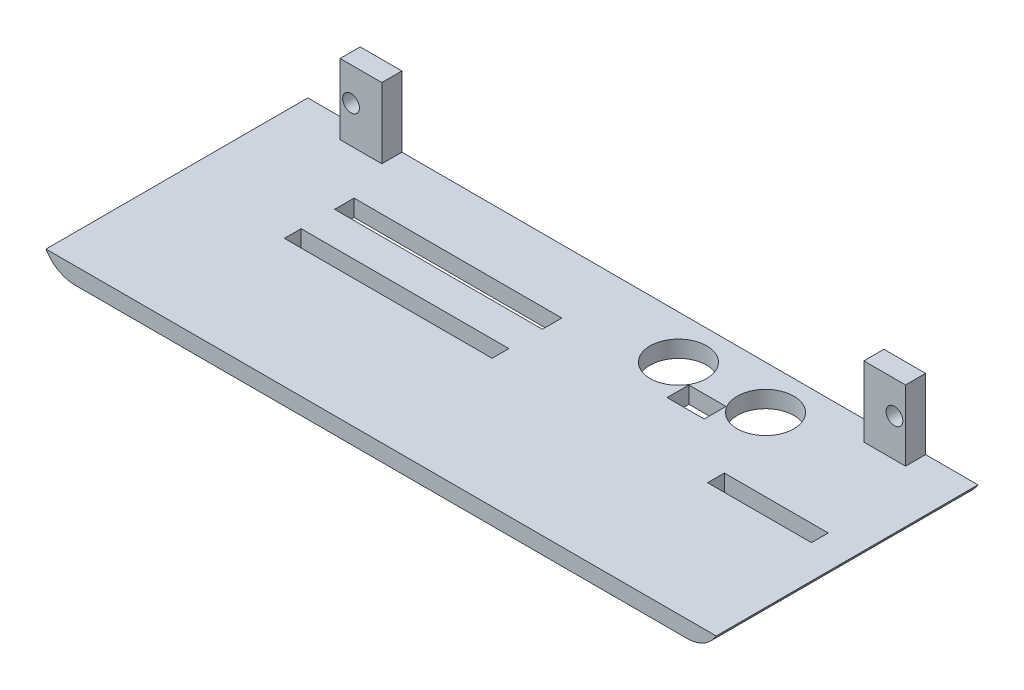
from build123d import *

# Parameters (mm, degrees)
CROQUIS2_W              = 200
CROQUIS2_H              = 150
CROQUIS2_R              = 2
CROQUIS2_R_2            = 2.5
CROQUIS2_W_2            = 31.297292299
CROQUIS2_H_2            = 43.768728426
CROQUIS2_H_3            = 43.768728427
CROQUIS2_W_3            = 23.573907934
CROQUIS2_H_4            = 45.323962431
SALIENTE_EXTRUIR1_DEPTH = 2
REDONDEO1_R             = 10
BOSS_EXTRUDE1_DEPTH     = 25
SKETCH3_W               = 62.040442094
SKETCH3_H               = 5.530821024
BOSS_EXTRUDE2_DEPTH     = 22
SKETCH8_W               = 62.040442094
SKETCH8_H               = 5.530821024
BOSS_EXTRUDE6_DEPTH     = 13
SKETCH2_W               = 200
SKETCH2_H               = 78.124132015
SKETCH2_W_2             = 62.040442094
SKETCH2_H_2             = 5.530821024
BOSS_EXTRUDE3_DEPTH     = 5
SKETCH4_W               = 62.040442094
SKETCH4_H               = 5.530821024
BOSS_EXTRUDE4_DEPTH     = 19
SKETCH5_W               = 7.442573222
SKETCH5_H               = 2.991451355
BOSS_EXTRUDE5_DEPTH     = 21
SKETCH6_R               = 2.5
CUT_EXTRUDE1_DEPTH      = 151.539762497
FILLET1_R               = 10
CUT_EXTRUDE2_DEPTH      = 153.054859813
CUT_EXTRUDE2_DEPTH_BACK = 13
SKETCH9_R               = 2.463920505
SKETCH9_R_2             = 2.5
SKETCH9_W               = 62.040442094
SKETCH9_H               = 4.214652984
CUT_EXTRUDE3_DEPTH      = 26
CUT_EXTRUDE3_DEPTH_BACK = 215.68865463
SKETCH10_W              = 2
SKETCH10_H              = 21
SKETCH11_W              = 62
SKETCH11_H              = 5.8
SKETCH11_H_2            = 5
SKETCH11_W_2            = 31
CUT_EXTRUDE4_DEPTH      = 130.932832439
CROQUIS4_W              = 2.991451355
CROQUIS4_H              = 16
SALIENTE_EXTRUIR2_DEPTH = 5
CROQUIS5_W              = 12.442573222
CROQUIS5_H              = 2.991451355
SALIENTE_EXTRUIR3_DEPTH = 5
CROQUIS7_W              = 12.442573222
CROQUIS7_H              = 21
SALIENTE_EXTRUIR4_DEPTH = 3
CORTAR_EXTRUIR3_START   = -15
CROQUIS8_R              = 2.5
CORTAR_EXTRUIR3_DEPTH   = 15
CROQUIS9_W              = 2.991451355
CROQUIS9_H              = 16
SALIENTE_EXTRUIR5_DEPTH = 5
CROQUIS10_W             = 12.442573222
CROQUIS10_H             = 2.991451355
SALIENTE_EXTRUIR6_DEPTH = 5
CROQUIS11_W             = 12.442573222
CROQUIS11_H             = 21
SALIENTE_EXTRUIR7_DEPTH = 3
CORTAR_EXTRUIR4_START   = -11
CROQUIS12_R             = 2.5
CORTAR_EXTRUIR4_DEPTH   = 11
CROQUIS15_R             = 8.45
CROQUIS15_W             = 10
CROQUIS15_H             = 5
CORTAR_EXTRUIR8_DEPTH   = 111
CORTAR_EXTRUIR10_DEPTH  = 10


with BuildPart() as part:
    # Croquis2 → Saliente-Extruir1 (new body)
    with BuildSketch(Plane.XY):
        with Locations((0.108263467, -0.36008145)):
            Rectangle(CROQUIS2_W, CROQUIS2_H)
        with Locations((89.108263467, -66.5)):
            Circle(CROQUIS2_R, mode=Mode.SUBTRACT)
        with Locations((-88.891736533, -66.5)):
            Circle(CROQUIS2_R, mode=Mode.SUBTRACT)
        with Locations(Location((89.108263467, 65.779837101, 0), (0, 0, 180))):
            Circle(CROQUIS2_R, mode=Mode.SUBTRACT)
        with Locations(Location((-88.891736533, 65.779837101, 0), (0, 0, 180))):
            Circle(CROQUIS2_R, mode=Mode.SUBTRACT)
        with Locations((-80.865436179, -59.36008145)):
            Circle(CROQUIS2_R_2, mode=Mode.SUBTRACT)
        with Locations((81.108263467, -59.36008145)):
            Circle(CROQUIS2_R_2, mode=Mode.SUBTRACT)
        with Locations(Location((81.108263467, 58.63991855, 0), (0, 0, 180))):
            Circle(CROQUIS2_R_2, mode=Mode.SUBTRACT)
        with Locations(Location((-80.865436179, 58.63991855, 0), (0, 0, 180))):
            Circle(CROQUIS2_R_2, mode=Mode.SUBTRACT)
        with BuildLine():
            Line((-62.091736533, 70.63991855), (64.108263467, 70.63991855))
            ThreePointArc((64.108263467, 70.63991855), (66.108263467, 68.63991855), (64.108263467, 66.63991855))
            Line((64.108263467, 66.63991855), (-62.091736533, 66.63991855))
            ThreePointArc((-62.091736533, 66.63991855), (-64.091736533, 68.63991855), (-62.091736533, 70.63991855))
        make_face(mode=Mode.SUBTRACT)
        Polygon((-71.391736533, -12.902447307), (-71.391736533, 12.182284408), (-79.241736533, 12.28991855), (-83.891736533, 12.28991855), (-83.891736533, -13.01008145), (-79.241736533, -13.01008145), align=None, mode=Mode.SUBTRACT)
        with BuildLine():
            Line((92.108263467, 45.478381757), (92.108263467, -46.198544657))
            ThreePointArc((92.108263467, -46.198544657), (90.807295546, -47.897576736), (89.108263467, -46.596608814))
            Line((89.108263467, -46.596608814), (89.108263467, 45.876445915))
            ThreePointArc((89.108263467, 45.876445915), (90.807295546, 47.177413836), (92.108263467, 45.478381757))
        make_face(mode=Mode.SUBTRACT)
        Polygon((84.108263467, 12.28991855), (84.108263467, -13.01008145), (79.458263467, -13.01008145), (71.608263467, -13.01008145), (71.608263467, 12.28991855), (79.458263467, 12.28991855), align=None, mode=Mode.SUBTRACT)
        with BuildLine():
            Line((-91.891736533, 45.478381757), (-91.891736533, -46.198544657))
            ThreePointArc((-91.891736533, -46.198544657), (-90.590768612, -47.897576736), (-88.891736533, -46.596608814))
            Line((-88.891736533, -46.596608814), (-88.891736533, 45.876445915))
            ThreePointArc((-88.891736533, 45.876445915), (-90.590768612, 47.177413836), (-91.891736533, 45.478381757))
        make_face(mode=Mode.SUBTRACT)
        with Locations((-30.011405388, 36.299005811)):
            Rectangle(CROQUIS2_W_2, CROQUIS2_H_2, mode=Mode.SUBTRACT)
        with BuildLine():
            Line((-62.091736533, -71.36008145), (64.108263467, -71.36008145))
            ThreePointArc((64.108263467, -71.36008145), (66.108263467, -69.36008145), (64.108263467, -67.36008145))
            Line((64.108263467, -67.36008145), (-62.091736533, -67.36008145))
            ThreePointArc((-62.091736533, -67.36008145), (-64.091736533, -69.36008145), (-62.091736533, -71.36008145))
        make_face(mode=Mode.SUBTRACT)
        with Locations((-30.011405388, -26.799059535)):
            Rectangle(CROQUIS2_W_2, CROQUIS2_H_3, mode=Mode.SUBTRACT)
        with Locations((12.982877294, -0.693345879)):
            Rectangle(CROQUIS2_W_3, CROQUIS2_H_4, mode=Mode.SUBTRACT)
    extrude(amount=SALIENTE_EXTRUIR1_DEPTH)

    # Redondeo1
    redondeo1_edges = [part.edges().sort_by_distance(p)[0] for p in [
        (100.108263467, -75.36008145, 1),
        (-99.891736533, -75.36008145, 1),
        (-99.891736533, 74.63991855, 1),
        (100.108263467, 74.63991855, 1),
    ]]
    fillet(redondeo1_edges, radius=REDONDEO1_R)

    # Sketch1 → Boss-Extrude1 (add)
    with BuildSketch(Plane.XY.offset(2)):
        Polygon((-67.071845217, 64.63991855), (-67.071845217, 60.63991855), (-8.841198185, 60.63991855), (-8.841198185, 3.63991855), (-67.071845217, 3.63991855), (-67.071845217, -0.36008145), (-8.841198185, -0.36008145), (-8.841198185, -53.36008145), (-67.071845217, -53.36008145), (-67.071845217, -57.574734434), (-5.031403123, -57.574734434), (-5.031403123, -40.931443482), (46.608263467, -40.931443482), (46.608263467, -36.931443482), (-5.031403123, -36.931443482), (-5.031403123, 30.068556518), (46.608263467, 30.068556518), (46.608263467, 34.068556518), (-5.031403123, 34.068556518), (-5.031403123, 64.63991855), align=None)
    extrude(amount=BOSS_EXTRUDE1_DEPTH)

    # Sketch3 → Boss-Extrude2 (add)
    with BuildSketch(Plane.XZ.offset(57.574734434)):
        with Locations((-36.05162417, 24.234589488)):
            Rectangle(SKETCH3_W, SKETCH3_H)
    extrude(amount=BOSS_EXTRUDE2_DEPTH)

    # Sketch8 → Boss-Extrude6 (add)
    with BuildSketch(Plane(origin=(0, 64.63991855, 0), x_dir=(1, 0, 0), z_dir=(0, 1, 0))):
        with Locations((-36.05162417, -24.234589488)):
            Rectangle(SKETCH8_W, SKETCH8_H)
    extrude(amount=BOSS_EXTRUDE6_DEPTH)

    # Sketch2 → Boss-Extrude3 (add)
    with BuildSketch(Plane.XZ.offset(75.36008145)):
        with Locations((0.108263467, 41.062066008)):
            Rectangle(SKETCH2_W, SKETCH2_H)
        with Locations((-36.05162417, 24.234589488)):
            Rectangle(SKETCH2_W_2, SKETCH2_H_2, mode=Mode.SUBTRACT)
    extrude(amount=-BOSS_EXTRUDE3_DEPTH)

    # Sketch4 → Boss-Extrude4 (add)
    with BuildSketch(Plane(origin=(0, 64.63991855, 0), x_dir=(1, 0, 0), z_dir=(0, 1, 0))):
        with Locations((-36.05162417, -24.234589488)):
            Rectangle(SKETCH4_W, SKETCH4_H)
    extrude(amount=BOSS_EXTRUDE4_DEPTH)

    # Sketch5 → Boss-Extrude5 (add)
    with BuildSketch(Plane.XZ.offset(75.36008145)):
        with Locations((-80.540187187, 3.495725678)):
            Rectangle(SKETCH5_W, SKETCH5_H)
        with Locations((80.756714122, 3.495725678)):
            Rectangle(SKETCH5_W, SKETCH5_H)
    extrude(amount=-BOSS_EXTRUDE5_DEPTH)

    # Sketch6 → Cut-Extrude1 (cut, through all)
    with BuildSketch(Plane.XY.offset(4.991451355)):
        with Locations((-80.996023003, -59.284349751)):
            Circle(SKETCH6_R)
        with Locations(Location((81.166025964, -59.051385225, 0), (0, 0, 345.800348631))):
            Circle(SKETCH6_R)
    extrude(amount=-CUT_EXTRUDE1_DEPTH, mode=Mode.SUBTRACT)

    # Fillet1
    # the kernel refuses this fillet: 10 mm, written as the material it takes off along each edge
    with BuildSketch(Plane(origin=(-99.891736533, -75.36008145, 101.77476711), x_dir=(1, 0, 0), z_dir=(0, 0, -1)), Plane(origin=(100.108263467, -75.36008145, -19.650635095), x_dir=(-1, 0, 0), z_dir=(0, 0, 1))) as fillet1_piece_1:
        with BuildLine():
            CenterArc((8.660254038, -10), FILLET1_R, 90, 60)
            Line((0, -5), (-0.173205081, -4.9))
            ThreePointArc((-0.173205081, -4.9), (-0.2, -2.5), (-0.2, 0))
            Line((-0.2, 0), (0, 0.2))
            Line((0, 0.2), (8.660254038, 0.2))
            Line((8.660254038, 0.2), (8.660254038, 0))
        make_face()
    extrude(amount=121.425402204, mode=Mode.SUBTRACT)

    # Sketch9 → Cut-Extrude2 (cut, two sides: drawn at the far end of the back side and taken through both)
    with BuildSketch(Plane.XY.offset(2).offset(-CUT_EXTRUDE2_DEPTH_BACK)):
        with Locations((-80.996023003, -59.284349751)):
            Circle(SKETCH9_R)
        with Locations(Location((81.166025964, -59.051385225, 0), (0, 0, 345.800348631))):
            Circle(SKETCH9_R_2)
        Polygon((-84.261473798, -70.36008145), (-84.261473798, -54.36008145), (-76.818900576, -54.36008145), (-76.818900576, -70.36008145), (77.035427511, -70.36008145), (77.035427511, -54.36008145), (84.478000733, -54.36008145), (84.478000733, -70.36008145), (100.108263467, -70.36008145), (100.108263467, 85.68147533), (-108.295057911, 85.68147533), (-108.295057911, -70.36008145), align=None)
        with Locations((-36.05162417, -77.467407942)):
            Rectangle(SKETCH9_W, SKETCH9_H)
    extrude(amount=CUT_EXTRUDE2_DEPTH + CUT_EXTRUDE2_DEPTH_BACK, mode=Mode.SUBTRACT)

    # Sketch10 → Cut-Extrude3 (cut, two sides: drawn at the far end of the back side and taken through both)
    with BuildSketch(Plane.ZY.offset(84.261473798).offset(-CUT_EXTRUDE3_DEPTH_BACK)):
        with Locations((1, -64.86008145)):
            Rectangle(SKETCH10_W, SKETCH10_H)
    extrude(amount=CUT_EXTRUDE3_DEPTH + CUT_EXTRUDE3_DEPTH_BACK, mode=Mode.SUBTRACT)

    # Sketch11 → Cut-Extrude4 (cut, through all)
    with BuildSketch(Plane.XZ.offset(75.36008145)):
        with Locations((-36.091736533, 23.891451355)):
            Rectangle(SKETCH11_W, SKETCH11_H)
        with Locations((-36.091736533, 39.291451355)):
            Rectangle(SKETCH11_W, SKETCH11_H_2)
        with Locations((74.708263467, 39.291451355)):
            Rectangle(SKETCH11_W_2, SKETCH11_H_2)
    extrude(amount=-CUT_EXTRUDE4_DEPTH, mode=Mode.SUBTRACT)

    # Croquis4 → Saliente-Extruir2 (add)
    with BuildSketch(Plane.ZY.offset(-77.035427511)):
        with Locations((3.495725678, -62.36008145)):
            Rectangle(CROQUIS4_W, CROQUIS4_H)
    extrude(amount=SALIENTE_EXTRUIR2_DEPTH)

    # Croquis5 → Saliente-Extruir3 (add)
    with BuildSketch(Plane(origin=(0, -54.36008145, 0), x_dir=(1, 0, 0), z_dir=(0, 1, 0))):
        with Locations((78.256714122, -3.495725678)):
            Rectangle(CROQUIS5_W, CROQUIS5_H)
    extrude(amount=SALIENTE_EXTRUIR3_DEPTH)

    # Croquis7 → Saliente-Extruir4 (add)
    with BuildSketch(Plane.XY.offset(4.991451355)):
        with Locations((78.256714122, -59.86008145)):
            Rectangle(CROQUIS7_W, CROQUIS7_H)
    extrude(amount=SALIENTE_EXTRUIR4_DEPTH)

    # Croquis8 → Cortar-Extruir3 (cut)
    with BuildSketch(Plane(origin=(0, 0, 2), x_dir=(-1, 0, 0), z_dir=(0, 0, -1)).offset(CORTAR_EXTRUIR3_START)):
        with Locations(Location((-81.166025964, -59.051385225, 0), (0, 0, 180))):
            Circle(CROQUIS8_R)
    extrude(amount=CORTAR_EXTRUIR3_DEPTH, mode=Mode.SUBTRACT)

    # Croquis9 → Saliente-Extruir5 (add)
    with BuildSketch(Plane(origin=(-76.818900576, 0, 0), x_dir=(0, 0, -1), z_dir=(1, 0, 0))):
        with Locations((-3.495725678, -62.36008145)):
            Rectangle(CROQUIS9_W, CROQUIS9_H)
    extrude(amount=SALIENTE_EXTRUIR5_DEPTH)

    # Croquis10 → Saliente-Extruir6 (add)
    with BuildSketch(Plane(origin=(0, -54.36008145, 0), x_dir=(1, 0, 0), z_dir=(0, 1, 0))):
        with Locations((-78.040187187, -3.495725678)):
            Rectangle(CROQUIS10_W, CROQUIS10_H)
    extrude(amount=SALIENTE_EXTRUIR6_DEPTH)

    # Croquis11 → Saliente-Extruir7 (add)
    with BuildSketch(Plane.XY.offset(4.991451355)):
        with Locations((-78.040187187, -59.86008145)):
            Rectangle(CROQUIS11_W, CROQUIS11_H)
    extrude(amount=SALIENTE_EXTRUIR7_DEPTH)

    # Croquis12 → Cortar-Extruir4 (cut)
    with BuildSketch(Plane(origin=(0, 0, 2), x_dir=(-1, 0, 0), z_dir=(0, 0, -1)).offset(CORTAR_EXTRUIR4_START)):
        with Locations(Location((80.996023003, -59.284349751, 0), (0, 0, 180))):
            Circle(CROQUIS12_R)
    extrude(amount=CORTAR_EXTRUIR4_DEPTH, mode=Mode.SUBTRACT)

    # Croquis15 → Cortar-Extruir8 (cut)
    with BuildSketch(Plane.XZ.offset(75.36008145)):
        with Locations(Location((23.708263467, 15, 0), (0, 0, 270))):
            Circle(CROQUIS15_R)
        with Locations(Location((49.708263467, 15, 0), (0, 0, 270))):
            Circle(CROQUIS15_R)
        with Locations((36.708263467, 21.84)):
            Rectangle(CROQUIS15_W, CROQUIS15_H)
    extrude(amount=-CORTAR_EXTRUIR8_DEPTH, mode=Mode.SUBTRACT)

    # Croquis16 → Cortar-Extruir10 (cut)
    with BuildSketch(Plane.XZ.offset(75.36008145)):
        Polygon((31.708263467, 25.84), (41.708263467, 25.84), (42.248263467, 25.84), (42.248263467, 19.34), (41.708263467, 19.34), (41.708263467, 24.34), (31.708263467, 24.34), (31.708263467, 19.34), (31.168263467, 19.34), (31.168263467, 25.84), align=None)
    extrude(amount=-CORTAR_EXTRUIR10_DEPTH, mode=Mode.SUBTRACT)


solid = part.part
